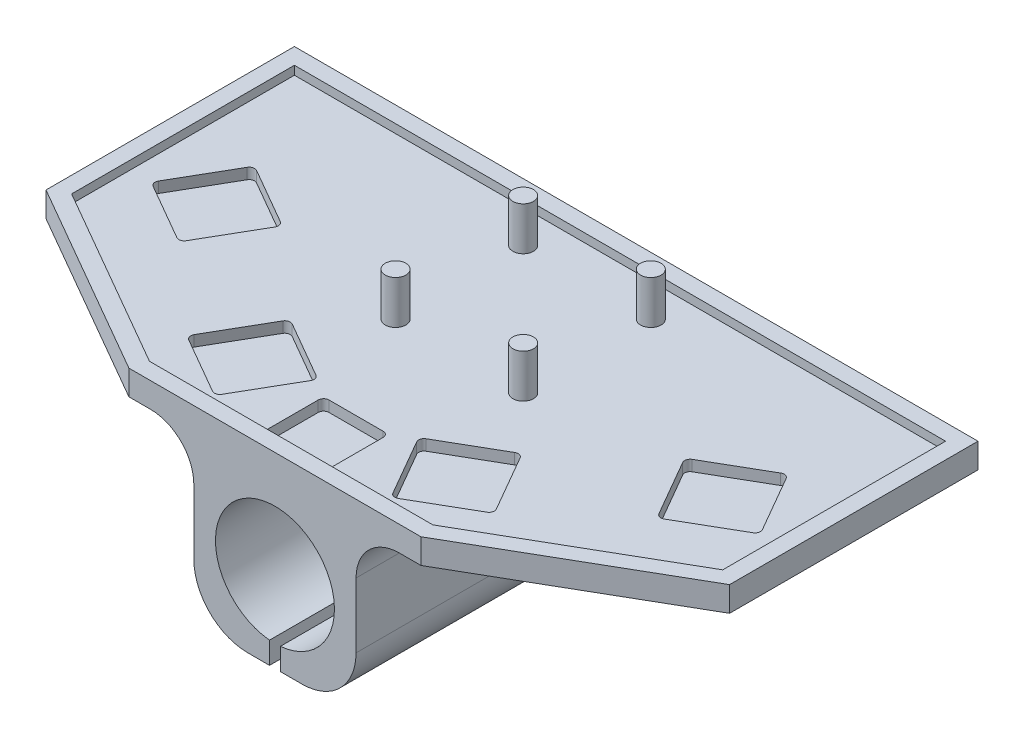
from build123d import *

# Parameters (mm, degrees)
EXTRUDE_1_DEPTH          = 1.6
EXTRUDE_2_DEPTH          = 3
SKETCH_3_W               = 12
SKETCH_3_H               = 12
CUT_EXTRUDE_1_DEPTH      = 2
FILLET_1_R               = 1
SKETCH_4_R               = 1.9
EXTRUDE_3_DEPTH          = 8
SKETCH_12_R              = 11
EXTRUDE_9_DEPTH          = 66.8
CUT_EXTRUDE_2_DEPTH      = 98.70097236
CUT_EXTRUDE_2_DEPTH_BACK = 98.70097236
SKETCH_13_W              = 2
SKETCH_13_H              = 4.04554885
CUT_EXTRUDE_5_DEPTH      = 107.182296076
CUT_EXTRUDE_5_DEPTH_BACK = 107.182296076
SKETCH_16_W              = 8
SKETCH_16_H              = 2
FILLET_2_R               = 8


with BuildPart() as part:
    # Эскиз1 → Бобышка-Вытянуть1 (new body)
    with BuildSketch(Plane(origin=(0, 0, 0), x_dir=(1, 0, 0), z_dir=(0, 1, 0))):
        Polygon((27.002786573, -63.8), (63.2, -42.933371083), (63.2, 3), (-63.2, 3), (-63.2, -42.933371083), (-27.002786573, -63.8), align=None)
        Polygon((60.2, -41.2), (60.2, 0), (-60.2, 0), (-60.2, -41.2), (-26.2, -60.8), (26.2, -60.8), align=None, mode=Mode.SUBTRACT)
    extrude(amount=EXTRUDE_1_DEPTH)

    # Эскиз2 → Бобышка-Вытянуть2 (add)
    with BuildSketch(Plane.XZ):
        Polygon((63.2, 42.933371083), (27.002786573, 63.8), (-27.002786573, 63.8), (-63.2, 42.933371083), (-63.2, -3), (63.2, -3), align=None)
    extrude(amount=EXTRUDE_2_DEPTH)

    # Эскиз3 → Вырез-Вытянуть1 (cut)
    with BuildSketch(Plane(origin=(0, 0, 0), x_dir=(1, 0, 0), z_dir=(0, 1, 0))):
        with Locations((0, -54.8)):
            Rectangle(SKETCH_3_W, SKETCH_3_H)
        Polygon((-21.436533479, -39.536860279), (-9.312177826, -46.536860279), (-16.312177826, -58.661215932), (-28.436533479, -51.661215932), align=None)
        Polygon((9.312177826, -46.536860279), (21.436533479, -39.536860279), (28.436533479, -51.661215932), (16.312177826, -58.661215932), align=None)
        Polygon((56.327549631, -30.362177826), (44.203193978, -37.362177826), (37.203193978, -25.237822174), (49.327549631, -18.237822174), align=None)
        Polygon((-44.203193978, -37.362177826), (-37.203193978, -25.237822174), (-49.327549631, -18.237822174), (-56.327549631, -30.362177826), align=None)
    extrude(amount=-CUT_EXTRUDE_1_DEPTH, mode=Mode.SUBTRACT)

    # Скругление1
    fillet_1_edges = [part.edges().sort_by_distance(p)[0] for p in [
        (-44.203193978, -1, 37.362177826),
        (-56.327549631, -1, 30.362177826),
        (-49.327549631, -1, 18.237822174),
        (-37.203193978, -1, 25.237822174),
        (49.327549631, -1, 18.237822174),
        (56.327549631, -1, 30.362177826),
        (44.203193978, -1, 37.362177826),
        (37.203193978, -1, 25.237822174),
        (-28.436533479, -1, 51.661215932),
        (-21.436533479, -1, 39.536860279),
        (-9.312177826, -1, 46.536860279),
        (-16.312177826, -1, 58.661215932),
        (16.312177826, -1, 58.661215932),
        (9.312177826, -1, 46.536860279),
        (21.436533479, -1, 39.536860279),
        (28.436533479, -1, 51.661215932),
        (-6, -1, 60.8),
        (-6, -1, 48.8),
        (6, -1, 48.8),
        (6, -1, 60.8),
    ]]
    fillet(fillet_1_edges, radius=FILLET_1_R)

    # Эскиз4 → Бобышка-Вытянуть3 (add)
    with BuildSketch(Plane(origin=(0, 0, 0), x_dir=(1, 0, 0), z_dir=(0, 1, 0))):
        with Locations(Location((-11.8, -6.1, 0), (0, 0, 90))):
            Circle(SKETCH_4_R)
        with Locations(Location((-11.8, -29.7, 0), (0, 0, 90))):
            Circle(SKETCH_4_R)
        with Locations(Location((11.8, -29.7, 0), (0, 0, 90))):
            Circle(SKETCH_4_R)
        with Locations(Location((11.8, -6.1, 0), (0, 0, 90))):
            Circle(SKETCH_4_R)
    extrude(amount=EXTRUDE_3_DEPTH)

    # Эскиз12 → Бобышка-Вытянуть9 (add)
    with BuildSketch(Plane.XY.offset(63.8)):
        with BuildLine():
            Line((-5, -33), (5, -33))
            ThreePointArc((5, -33), (12.071067812, -30.071067812), (15, -23))
            Line((15, -23), (15, -3))
            Line((15, -3), (-15, -3))
            Line((-15, -3), (-15, -23))
            ThreePointArc((-15, -23), (-12.071067812, -30.071067812), (-5, -33))
        make_face()
        with Locations((0, -18)):
            Circle(SKETCH_12_R, mode=Mode.SUBTRACT)
    extrude(amount=-EXTRUDE_9_DEPTH)

    # Эскиз13 → Вырез-Вытянуть2 (cut, two sides: drawn at the far end of the back side and taken through both)
    with BuildSketch(Plane(origin=(0, 0, -3), x_dir=(-1, 0, 0), z_dir=(0, 0, -1)).offset(-CUT_EXTRUDE_2_DEPTH_BACK)):
        with Locations((0, -30.977225575)):
            Rectangle(SKETCH_13_W, SKETCH_13_H)
    extrude(amount=CUT_EXTRUDE_2_DEPTH + CUT_EXTRUDE_2_DEPTH_BACK, mode=Mode.SUBTRACT)

    # Эскиз16 → Вырез-Вытянуть5 (cut, two sides: drawn at the far end of the back side and taken through both)
    with BuildSketch(Plane.ZY.offset(15).offset(-CUT_EXTRUDE_5_DEPTH_BACK)):
        with Locations((13, -4)):
            Rectangle(SKETCH_16_W, SKETCH_16_H)
        with Locations((47.8, -4)):
            Rectangle(SKETCH_16_W, SKETCH_16_H)
    extrude(amount=CUT_EXTRUDE_5_DEPTH + CUT_EXTRUDE_5_DEPTH_BACK, mode=Mode.SUBTRACT)

    # Скругление2
    # the kernel refuses this fillet: 8 mm, written as the material it adds along each edge
    with BuildSketch(Plane(origin=(15, -3, 29), x_dir=(0, -1, 0), z_dir=(0, 0, -1))) as fillet_2_piece_1_section:
        with BuildLine():
            CenterArc((FILLET_2_R, -FILLET_2_R), FILLET_2_R, 90, 90)
            Line((0, -FILLET_2_R), (0, 0))
            Line((0, 0), (FILLET_2_R, 0))
        make_face()
    fillet_2_piece_1 = extrude(amount=32, mode=Mode.PRIVATE)
    fillet_2_piece_1 = split(fillet_2_piece_1, bisect_by=Plane(origin=(15.781963001, -5, 23), z_dir=(0, -1, 0)), keep=Keep.TOP, mode=Mode.PRIVATE)
    add(fillet_2_piece_1)
    with BuildSketch(Plane(origin=(15, -3, 29), x_dir=(0, -1, 0), z_dir=(0, 0, -1))) as fillet_2_piece_2_section:
        with BuildLine():
            CenterArc((FILLET_2_R, -FILLET_2_R), FILLET_2_R, 90, 90)
            Line((0, -FILLET_2_R), (0, 0))
            Line((0, 0), (FILLET_2_R, 0))
        make_face()
    fillet_2_piece_2 = extrude(amount=52, mode=Mode.PRIVATE)
    fillet_2_piece_2 = split(fillet_2_piece_2, bisect_by=Plane(origin=(17.359978734, -3.841824997, 17), z_dir=(0, 0, 1)), keep=Keep.TOP, mode=Mode.PRIVATE)
    add(fillet_2_piece_2)
    with BuildSketch(Plane(origin=(15, -3, 9), x_dir=(0, -1, 0), z_dir=(0, 0, -1)), Plane(origin=(15, -3, 63.8), x_dir=(0, -1, 0), z_dir=(0, 0, -1))) as fillet_2_piece_3:
        with BuildLine():
            CenterArc((FILLET_2_R, -FILLET_2_R), FILLET_2_R, 90, 90)
            Line((0, -FILLET_2_R), (0, 0))
            Line((0, 0), (FILLET_2_R, 0))
        make_face()
    extrude(amount=12)
    with BuildSketch(Plane(origin=(-15, -3, 29), x_dir=(0, -1, 0), z_dir=(0, 0, -1))) as fillet_2_piece_4_section:
        with BuildLine():
            CenterArc((FILLET_2_R, FILLET_2_R), FILLET_2_R, 180, 90)
            Line((0, FILLET_2_R), (0, 0))
            Line((0, 0), (FILLET_2_R, 0))
        make_face()
    fillet_2_piece_4 = extrude(amount=32, mode=Mode.PRIVATE)
    fillet_2_piece_4 = split(fillet_2_piece_4, bisect_by=Plane(origin=(-15.781963001, -5, 23), z_dir=(0, -1, 0)), keep=Keep.TOP, mode=Mode.PRIVATE)
    add(fillet_2_piece_4)
    with BuildSketch(Plane(origin=(-15, -3, 29), x_dir=(0, -1, 0), z_dir=(0, 0, -1))) as fillet_2_piece_5_section:
        with BuildLine():
            CenterArc((FILLET_2_R, FILLET_2_R), FILLET_2_R, 180, 90)
            Line((0, FILLET_2_R), (0, 0))
            Line((0, 0), (FILLET_2_R, 0))
        make_face()
    fillet_2_piece_5 = extrude(amount=52, mode=Mode.PRIVATE)
    fillet_2_piece_5 = split(fillet_2_piece_5, bisect_by=Plane(origin=(-17.359978734, -3.841824997, 17), z_dir=(0, 0, 1)), keep=Keep.TOP, mode=Mode.PRIVATE)
    add(fillet_2_piece_5)
    with BuildSketch(Plane(origin=(-15, -3, 9), x_dir=(0, -1, 0), z_dir=(0, 0, -1)), Plane(origin=(-15, -3, 63.8), x_dir=(0, -1, 0), z_dir=(0, 0, -1))) as fillet_2_piece_6:
        with BuildLine():
            CenterArc((FILLET_2_R, FILLET_2_R), FILLET_2_R, 180, 90)
            Line((0, FILLET_2_R), (0, 0))
            Line((0, 0), (FILLET_2_R, 0))
        make_face()
    extrude(amount=12)
    with BuildSketch(Plane(origin=(15, -3, 63.8), x_dir=(0, -1, 0), z_dir=(0, 0, -1))) as fillet_2_piece_7_section:
        with BuildLine():
            CenterArc((FILLET_2_R, -FILLET_2_R), FILLET_2_R, 90, 90)
            Line((0, -FILLET_2_R), (0, 0))
            Line((0, 0), (FILLET_2_R, 0))
        make_face()
    fillet_2_piece_7 = extrude(amount=66.8, mode=Mode.PRIVATE)
    fillet_2_piece_7 = split(fillet_2_piece_7, bisect_by=Plane(origin=(15.781963001, -5, 57.8), z_dir=(0, -1, 0)), keep=Keep.TOP, mode=Mode.PRIVATE)
    add(fillet_2_piece_7)
    with BuildSketch(Plane(origin=(15, -3, 63.8), x_dir=(0, -1, 0), z_dir=(0, 0, -1))) as fillet_2_piece_8_section:
        with BuildLine():
            CenterArc((FILLET_2_R, -FILLET_2_R), FILLET_2_R, 90, 90)
            Line((0, -FILLET_2_R), (0, 0))
            Line((0, 0), (FILLET_2_R, 0))
        make_face()
    fillet_2_piece_8 = extrude(amount=66.8, mode=Mode.PRIVATE)
    fillet_2_piece_8 = split(fillet_2_piece_8, bisect_by=Plane(origin=(17.359978734, -3.841824997, 51.8), z_dir=(0, 0, 1)), keep=Keep.TOP, mode=Mode.PRIVATE)
    add(fillet_2_piece_8)
    with BuildSketch(Plane(origin=(15, -3, 43.8), x_dir=(0, -1, 0), z_dir=(0, 0, -1))) as fillet_2_piece_9:
        with BuildLine():
            CenterArc((FILLET_2_R, -FILLET_2_R), FILLET_2_R, 90, 90)
            Line((0, -FILLET_2_R), (0, 0))
            Line((0, 0), (FILLET_2_R, 0))
        make_face()
    extrude(amount=26.8)
    with BuildSketch(Plane(origin=(15, -3, 63.8), x_dir=(0, -1, 0), z_dir=(0, 0, -1))) as fillet_2_piece_10_section:
        with BuildLine():
            CenterArc((FILLET_2_R, -FILLET_2_R), FILLET_2_R, 90, 90)
            Line((0, -FILLET_2_R), (0, 0))
            Line((0, 0), (FILLET_2_R, 0))
        make_face()
    fillet_2_piece_10 = extrude(amount=66.8, mode=Mode.PRIVATE)
    fillet_2_piece_10 = split(fillet_2_piece_10, bisect_by=Plane(origin=(17.359978734, -3.841824997, 9), z_dir=(0, 0, -1)), keep=Keep.TOP, mode=Mode.PRIVATE)
    add(fillet_2_piece_10)
    with BuildSketch(Plane(origin=(15, -3, 63.8), x_dir=(0, -1, 0), z_dir=(0, 0, -1))) as fillet_2_piece_11_section:
        with BuildLine():
            CenterArc((FILLET_2_R, -FILLET_2_R), FILLET_2_R, 90, 90)
            Line((0, -FILLET_2_R), (0, 0))
            Line((0, 0), (FILLET_2_R, 0))
        make_face()
    fillet_2_piece_11 = extrude(amount=32, mode=Mode.PRIVATE)
    fillet_2_piece_11 = split(fillet_2_piece_11, bisect_by=Plane(origin=(15.781963001, -5, 57.8), z_dir=(0, -1, 0)), keep=Keep.TOP, mode=Mode.PRIVATE)
    add(fillet_2_piece_11)
    with BuildSketch(Plane(origin=(15, -3, 83.8), x_dir=(0, -1, 0), z_dir=(0, 0, -1))) as fillet_2_piece_12_section:
        with BuildLine():
            CenterArc((FILLET_2_R, -FILLET_2_R), FILLET_2_R, 90, 90)
            Line((0, -FILLET_2_R), (0, 0))
            Line((0, 0), (FILLET_2_R, 0))
        make_face()
    fillet_2_piece_12 = extrude(amount=52, mode=Mode.PRIVATE)
    fillet_2_piece_12 = split(fillet_2_piece_12, bisect_by=Plane(origin=(17.359978734, -3.841824997, 43.8), z_dir=(0, 0, -1)), keep=Keep.TOP, mode=Mode.PRIVATE)
    add(fillet_2_piece_12)
    with BuildSketch(Plane(origin=(-15, -3, 63.8), x_dir=(0, -1, 0), z_dir=(0, 0, -1))) as fillet_2_piece_13_section:
        with BuildLine():
            CenterArc((FILLET_2_R, FILLET_2_R), FILLET_2_R, 180, 90)
            Line((0, FILLET_2_R), (0, 0))
            Line((0, 0), (FILLET_2_R, 0))
        make_face()
    fillet_2_piece_13 = extrude(amount=66.8, mode=Mode.PRIVATE)
    fillet_2_piece_13 = split(fillet_2_piece_13, bisect_by=Plane(origin=(-15.781963001, -5, 57.8), z_dir=(0, -1, 0)), keep=Keep.TOP, mode=Mode.PRIVATE)
    add(fillet_2_piece_13)
    with BuildSketch(Plane(origin=(-15, -3, 63.8), x_dir=(0, -1, 0), z_dir=(0, 0, -1))) as fillet_2_piece_14_section:
        with BuildLine():
            CenterArc((FILLET_2_R, FILLET_2_R), FILLET_2_R, 180, 90)
            Line((0, FILLET_2_R), (0, 0))
            Line((0, 0), (FILLET_2_R, 0))
        make_face()
    fillet_2_piece_14 = extrude(amount=66.8, mode=Mode.PRIVATE)
    fillet_2_piece_14 = split(fillet_2_piece_14, bisect_by=Plane(origin=(-17.359978734, -3.841824997, 51.8), z_dir=(0, 0, 1)), keep=Keep.TOP, mode=Mode.PRIVATE)
    add(fillet_2_piece_14)
    with BuildSketch(Plane(origin=(-15, -3, 43.8), x_dir=(0, -1, 0), z_dir=(0, 0, -1))) as fillet_2_piece_15:
        with BuildLine():
            CenterArc((FILLET_2_R, FILLET_2_R), FILLET_2_R, 180, 90)
            Line((0, FILLET_2_R), (0, 0))
            Line((0, 0), (FILLET_2_R, 0))
        make_face()
    extrude(amount=26.8)
    with BuildSketch(Plane(origin=(-15, -3, 63.8), x_dir=(0, -1, 0), z_dir=(0, 0, -1))) as fillet_2_piece_16_section:
        with BuildLine():
            CenterArc((FILLET_2_R, FILLET_2_R), FILLET_2_R, 180, 90)
            Line((0, FILLET_2_R), (0, 0))
            Line((0, 0), (FILLET_2_R, 0))
        make_face()
    fillet_2_piece_16 = extrude(amount=66.8, mode=Mode.PRIVATE)
    fillet_2_piece_16 = split(fillet_2_piece_16, bisect_by=Plane(origin=(-17.359978734, -3.841824997, 9), z_dir=(0, 0, -1)), keep=Keep.TOP, mode=Mode.PRIVATE)
    add(fillet_2_piece_16)
    with BuildSketch(Plane(origin=(-15, -3, 63.8), x_dir=(0, -1, 0), z_dir=(0, 0, -1))) as fillet_2_piece_17_section:
        with BuildLine():
            CenterArc((FILLET_2_R, FILLET_2_R), FILLET_2_R, 180, 90)
            Line((0, FILLET_2_R), (0, 0))
            Line((0, 0), (FILLET_2_R, 0))
        make_face()
    fillet_2_piece_17 = extrude(amount=32, mode=Mode.PRIVATE)
    fillet_2_piece_17 = split(fillet_2_piece_17, bisect_by=Plane(origin=(-15.781963001, -5, 57.8), z_dir=(0, -1, 0)), keep=Keep.TOP, mode=Mode.PRIVATE)
    add(fillet_2_piece_17)
    with BuildSketch(Plane(origin=(-15, -3, 83.8), x_dir=(0, -1, 0), z_dir=(0, 0, -1))) as fillet_2_piece_18_section:
        with BuildLine():
            CenterArc((FILLET_2_R, FILLET_2_R), FILLET_2_R, 180, 90)
            Line((0, FILLET_2_R), (0, 0))
            Line((0, 0), (FILLET_2_R, 0))
        make_face()
    fillet_2_piece_18 = extrude(amount=52, mode=Mode.PRIVATE)
    fillet_2_piece_18 = split(fillet_2_piece_18, bisect_by=Plane(origin=(-17.359978734, -3.841824997, 43.8), z_dir=(0, 0, -1)), keep=Keep.TOP, mode=Mode.PRIVATE)
    add(fillet_2_piece_18)


solid = part.part
